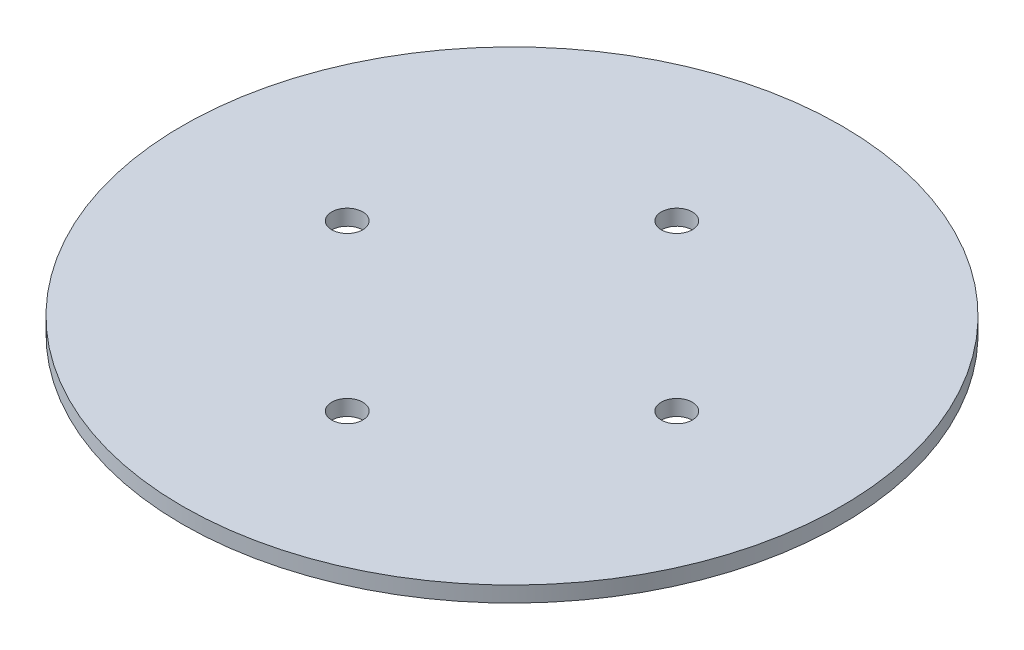
from build123d import *

# Parameters (mm, degrees)
SKETCH2_R                = 25.5
BASE_FLANGE1_DEPTH       = 1.21
M2_CLEARANCE_HOLE1_D     = 2.4
M2_CLEARANCE_HOLE1_DEPTH = 10
M2_CLEARANCE_HOLE1_TIP   = 0.721032743


# Sheet-metal steps are written as plain solids
with BuildPart() as part:
    # Sketch2 → Base-Flange1 (new body)
    with BuildSketch(Plane(origin=(0, 0, 0), x_dir=(1, 0, 0), z_dir=(0, 1, 0))):
        with Locations(Location((0, 0, 0), (0, 0, 270))):
            Circle(SKETCH2_R)
    extrude(amount=-BASE_FLANGE1_DEPTH)

    # M2 Clearance Hole1
    with Locations(Plane(origin=(0, -1.21, 0), x_dir=(-1, 0, 0), z_dir=(0, -1, 0))):
        with Locations((0, -12.75), (-12.75, 0), (12.75, 0), (0, 12.75)):
            Hole(M2_CLEARANCE_HOLE1_D / 2, depth=M2_CLEARANCE_HOLE1_DEPTH)
            with Locations((0, 0, -(M2_CLEARANCE_HOLE1_DEPTH + M2_CLEARANCE_HOLE1_TIP / 2))):  # 118° drill point
                Cone(0, M2_CLEARANCE_HOLE1_D / 2, M2_CLEARANCE_HOLE1_TIP, mode=Mode.SUBTRACT)


solid = part.part
